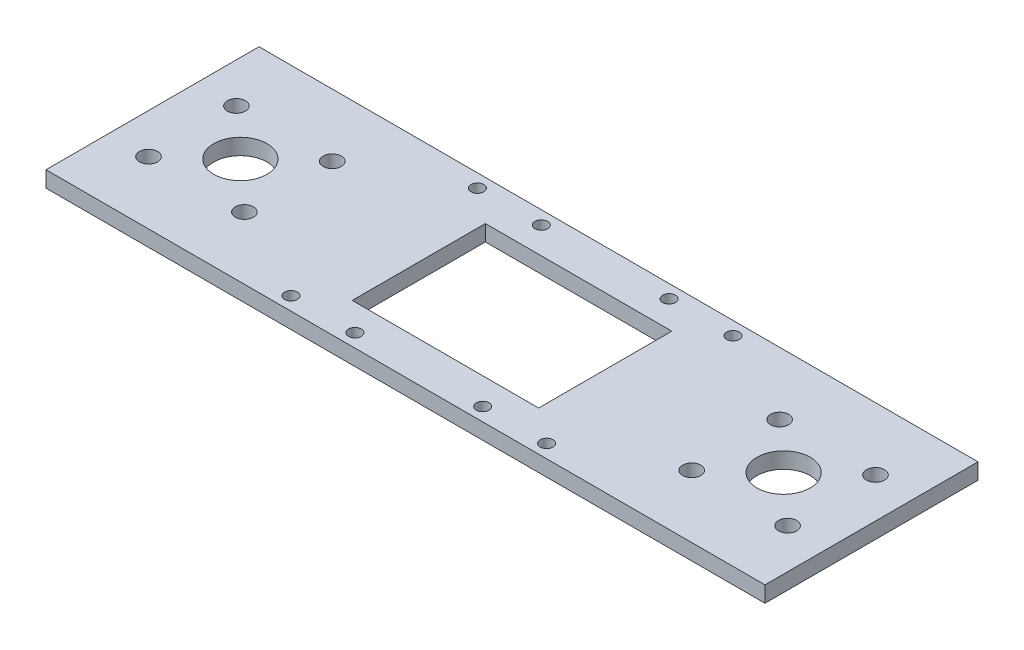
from build123d import *

# Parameters (mm, degrees)
SKETCH1_W           = 135
SKETCH1_H           = 40
SKETCH1_R           = 5
SKETCH1_R_2         = 1.7
SKETCH1_W_2         = 10
SKETCH1_H_2         = 20
BOSS_EXTRUDE1_DEPTH = 3
SKETCH3_R           = 1.2
CUT_EXTRUDE1_DEPTH  = 71.464530084
SKETCH4_W           = 35
SKETCH4_H           = 25
CUT_EXTRUDE2_DEPTH  = 71.464530084


with BuildPart() as part:
    # Sketch1 → Boss-Extrude1 (new body)
    with BuildSketch(Plane(origin=(0, 0, 0), x_dir=(1, 0, 0), z_dir=(0, 1, 0))):
        Rectangle(SKETCH1_W, SKETCH1_H)
        with Locations((-51, 0)):
            Circle(SKETCH1_R, mode=Mode.SUBTRACT)
        with Locations((-60, 8.25)):
            Circle(SKETCH1_R_2, mode=Mode.SUBTRACT)
        with Locations((-42, 8.25)):
            Circle(SKETCH1_R_2, mode=Mode.SUBTRACT)
        with Locations((-42, -8.25)):
            Circle(SKETCH1_R_2, mode=Mode.SUBTRACT)
        with Locations((-60, -8.25)):
            Circle(SKETCH1_R_2, mode=Mode.SUBTRACT)
        with Locations((51, 0)):
            Circle(SKETCH1_R, mode=Mode.SUBTRACT)
        with Locations((42, 8.25)):
            Circle(SKETCH1_R_2, mode=Mode.SUBTRACT)
        with Locations((42, -8.25)):
            Circle(SKETCH1_R_2, mode=Mode.SUBTRACT)
        with Locations((60, -8.25)):
            Circle(SKETCH1_R_2, mode=Mode.SUBTRACT)
        with Locations((60, 8.25)):
            Circle(SKETCH1_R_2, mode=Mode.SUBTRACT)
        Rectangle(SKETCH1_W_2, SKETCH1_H_2, mode=Mode.SUBTRACT)
    extrude(amount=BOSS_EXTRUDE1_DEPTH)

    # Sketch3 → Cut-Extrude1 (cut, through all)
    with BuildSketch(Plane(origin=(0, 3, 0), x_dir=(1, 0, 0), z_dir=(0, 1, 0))):
        with Locations((-12, 17.5)):
            Circle(SKETCH3_R)
        with Locations((-12, -17.5)):
            Circle(SKETCH3_R)
        with Locations((-24, 17.5)):
            Circle(SKETCH3_R)
        with Locations((-24, -17.5)):
            Circle(SKETCH3_R)
        with Locations((24, -17.5)):
            Circle(SKETCH3_R)
        with Locations((24, 17.5)):
            Circle(SKETCH3_R)
        with Locations((12, -17.5)):
            Circle(SKETCH3_R)
        with Locations((12, 17.5)):
            Circle(SKETCH3_R)
    extrude(amount=-CUT_EXTRUDE1_DEPTH, mode=Mode.SUBTRACT)

    # Sketch4 → Cut-Extrude2 (cut, through all)
    with BuildSketch(Plane(origin=(0, 3, 0), x_dir=(1, 0, 0), z_dir=(0, 1, 0))):
        Rectangle(SKETCH4_W, SKETCH4_H)
    extrude(amount=-CUT_EXTRUDE2_DEPTH, mode=Mode.SUBTRACT)


solid = part.part
